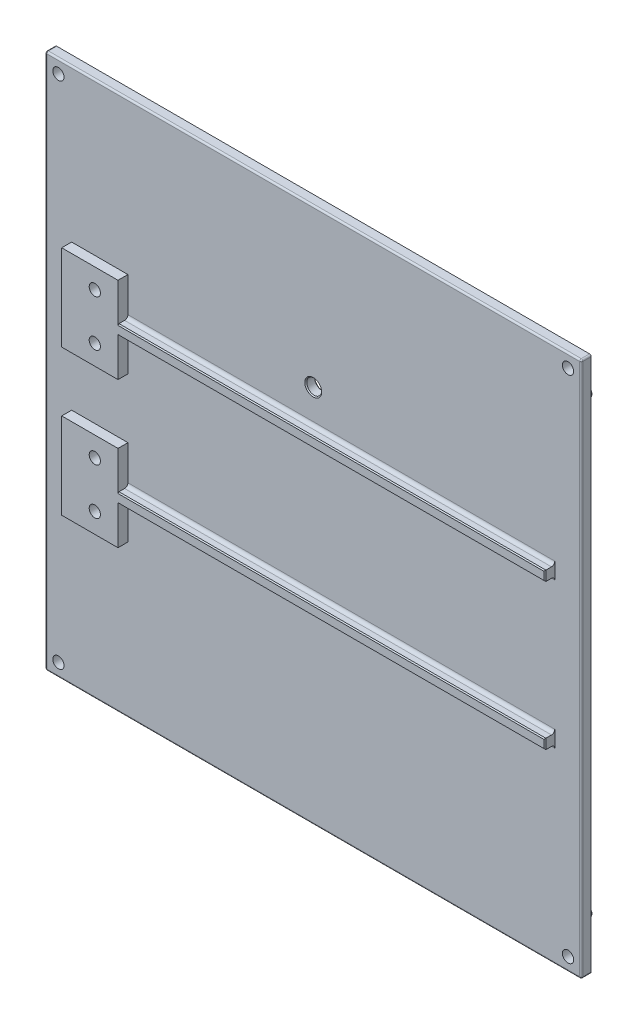
from build123d import *

# Parameters (mm, degrees)
SKETCH_1_W                                  = 162
SKETCH_1_H                                  = 162
EXTRUDE_309_DEPTH                           = 3
SKETCH_2_R                                  = 1.5
EXTRUDE_522_DEPTH                           = 3
MIRROR_568_AT_THE_SECOND_PLANE_COPY_1_SK_R  = 1.5
MIRROR_568_AT_THE_SECOND_PLANE_COPY_1_DEPTH = 3
CHAMFER_595_SIZE                            = 0.3
SKETCH_3_R                                  = 1.7
CUT_EXTRUDE_885_DEPTH                       = 115.590575529
MIRROR_923_AT_THE_SECOND_PLANE_COPY_1_SK_R  = 1.7
MIRROR_923_AT_THE_SECOND_PLANE_COPY_1_DEPTH = 115.590575529
SKETCH_4_W                                  = 20
SKETCH_4_H                                  = 26
EXTRUDE_1171_DEPTH                          = 3
SKETCH_5_R                                  = 1.7
CUT_EXTRUDE_1430_DEPTH                      = 115.904308013
SKETCH_6_R                                  = 2.25
CUT_EXTRUDE_1848_DEPTH                      = 115.708325766
CUT_EXTRUDE_2245_DEPTH                      = 2.6
PATTERN_LINEAR_2_COUNT                      = 2
PATTERN_LINEAR_2_PITCH                      = 14
MIRROR_2370_COPY_1_DEPTH                    = 2.6
SKETCH_8_W                                  = 3
SKETCH_8_H                                  = 26
CUT_EXTRUDE_2563_DEPTH                      = 3
SKETCH_10_W                                 = 129
SKETCH_10_H                                 = 3
EXTRUDE_3082_DEPTH                          = 3
FILLET_2_R                                  = 1
CHAMFER_2_SIZE                              = 0.3
CHAMFER_3_SIZE                              = 0.3
CHAMFER_4_SIZE                              = 0.3
FILLET_3_R                                  = 0.5
FILLET_5_R                                  = 0.5


with BuildPart() as part:
    # Эскиз1 → Extrude 309 (new body)
    with BuildSketch(Plane.XY):
        Rectangle(SKETCH_1_W, SKETCH_1_H)
    extrude(amount=EXTRUDE_309_DEPTH)

    # Эскиз2 → Extrude 522 (add)
    with BuildSketch(Plane(origin=(0, 0, 0), x_dir=(-1, 0, 0), z_dir=(0, 0, -1))):
        with Locations((-77, 68)):
            Circle(SKETCH_2_R)
    extrude_522 = extrude(amount=EXTRUDE_522_DEPTH)

    # Mirror 568: Extrude 522 across plane
    add(extrude_522.mirror(Plane(origin=(0, 0, 0), x_dir=(0, 0, 1), z_dir=(1, 0, 0))))

    # Mirror 568 at the second plane: Extrude 522 across plane
    add(extrude_522.mirror(Plane.ZX))

    # Mirror 568 at the second plane copy 1 sk → Mirror 568 at the second plane copy 1 (add)
    with BuildSketch(Plane(origin=(0, 0, 0), x_dir=(1, 0, 0), z_dir=(0, 0, -1))):
        with Locations((-77, 68)):
            Circle(MIRROR_568_AT_THE_SECOND_PLANE_COPY_1_SK_R)
    extrude(amount=MIRROR_568_AT_THE_SECOND_PLANE_COPY_1_DEPTH)

    # Chamfer 595
    chamfer_595_edges = [part.edges().sort_by_distance(p)[0] for p in [
        (78.5, 68, -3),
        (78.5, -68, -3),
        (-78.5, 68, 0),
        (-78.5, -68, -3),
    ]]
    chamfer(chamfer_595_edges, length=CHAMFER_595_SIZE)

    # Эскиз3 → Cut-Extrude 885 (cut, through all)
    with BuildSketch(Plane(origin=(0, 0, 0), x_dir=(-1, 0, 0), z_dir=(0, 0, -1))):
        with Locations((-77, 77)):
            Circle(SKETCH_3_R)
    cut_extrude_885 = extrude(amount=-CUT_EXTRUDE_885_DEPTH, mode=Mode.SUBTRACT)

    # Mirror 923: Cut-Extrude 885 across plane
    add(cut_extrude_885.mirror(Plane(origin=(0, 0, 0), x_dir=(0, 0, 1), z_dir=(1, 0, 0))), mode=Mode.SUBTRACT)

    # Mirror 923 at the second plane: Cut-Extrude 885 across plane
    add(cut_extrude_885.mirror(Plane.ZX), mode=Mode.SUBTRACT)

    # Mirror 923 at the second plane copy 1 sk → Mirror 923 at the second plane copy 1 (cut, through all)
    with BuildSketch(Plane(origin=(0, 0, 0), x_dir=(1, 0, 0), z_dir=(0, 0, -1))):
        with Locations((-77, 77)):
            Circle(MIRROR_923_AT_THE_SECOND_PLANE_COPY_1_SK_R)
    extrude(amount=-MIRROR_923_AT_THE_SECOND_PLANE_COPY_1_DEPTH, mode=Mode.SUBTRACT)

    # Эскиз4 → Extrude 1171 (add)
    with BuildSketch(Plane.XY.offset(3)):
        with Locations((-63, 22)):
            Rectangle(SKETCH_4_W, SKETCH_4_H)
    extrude_1171 = extrude(amount=EXTRUDE_1171_DEPTH)

    # Эскиз5 → Cut-Extrude 1430 (cut, through all)
    with BuildSketch(Plane.XY.offset(6)):
        with Locations((-63, 29)):
            Circle(SKETCH_5_R)
        with Locations(Location((-63, 15, 0), (0, 0, 180))):
            Circle(SKETCH_5_R)
    cut_extrude_1430 = extrude(amount=-CUT_EXTRUDE_1430_DEPTH, mode=Mode.SUBTRACT)

    # Зеркальное отражение3: Extrude 1171, Cut-Extrude 1430 across plane
    add(extrude_1171.mirror(Plane.ZX))
    add(cut_extrude_1430.mirror(Plane.ZX), mode=Mode.SUBTRACT)

    # Эскиз6 → Cut-Extrude 1848 (cut, through all)
    with BuildSketch(Plane.XY.offset(3)):
        with Locations((0, 33.5)):
            Circle(SKETCH_6_R)
    extrude(amount=-CUT_EXTRUDE_1848_DEPTH, mode=Mode.SUBTRACT)

    # Эскиз7 → Cut-Extrude 2245 (cut)
    with BuildSketch(Plane(origin=(0, 0, 0), x_dir=(-1, 0, 0), z_dir=(0, 0, -1))):
        Polygon((66.348631561, 29), (64.674315781, 31.9), (61.325684219, 31.9), (59.651368439, 29), (61.325684219, 26.1), (64.674315781, 26.1), align=None)
    cut_extrude_2245 = extrude(amount=-CUT_EXTRUDE_2245_DEPTH, mode=Mode.SUBTRACT)

    # Карман2: Cut-Extrude 2245 ×2
    with Locations(*[(0, -i * PATTERN_LINEAR_2_PITCH, 0) for i in range(1, PATTERN_LINEAR_2_COUNT)]):
        add(cut_extrude_2245, mode=Mode.SUBTRACT)

    # Mirror 2370: Cut-Extrude 2245 across plane
    add(cut_extrude_2245.mirror(Plane.ZX), mode=Mode.SUBTRACT)

    # Mirror 2370 copy 1 sketch → Mirror 2370 copy 1 (cut)
    with BuildSketch(Plane(origin=(0, 14, 0), x_dir=(-1, 0, 0), z_dir=(0, 0, -1))):
        Polygon((66.348631561, -29), (64.674315781, -31.9), (61.325684219, -31.9), (59.651368439, -29), (61.325684219, -26.1), (64.674315781, -26.1), align=None)
    extrude(amount=-MIRROR_2370_COPY_1_DEPTH, mode=Mode.SUBTRACT)

    # Эскиз8 → Cut-Extrude 2563 (cut)
    with BuildSketch(Plane.XY.offset(6)):
        with Locations((-54.5, 22)):
            Rectangle(SKETCH_8_W, SKETCH_8_H)
    cut_extrude_2563 = extrude(amount=-CUT_EXTRUDE_2563_DEPTH, mode=Mode.SUBTRACT)

    # Mirror 2615: Cut-Extrude 2563 across plane
    add(cut_extrude_2563.mirror(Plane.ZX), mode=Mode.SUBTRACT)

    # Эскиз10 → Extrude 3082 (add)
    with BuildSketch(Plane.XY.offset(3)):
        with Locations((8.5, 22)):
            Rectangle(SKETCH_10_W, SKETCH_10_H)
    extrude_3082 = extrude(amount=EXTRUDE_3082_DEPTH)

    # Mirror 3134: Extrude 3082 across plane
    add(extrude_3082.mirror(Plane.ZX))

    # Скругление2
    fillet_2_edges = [part.edges().sort_by_distance(p)[0] for p in [
        (8.5, 23.5, 3),
        (8.5, 20.5, 3),
        (8.5, -23.5, 3),
        (8.5, -20.5, 3),
    ]]
    fillet(fillet_2_edges, radius=FILLET_2_R)

    # Фаска2
    chamfer_2_edges = [part.edges().sort_by_distance(p)[0] for p in [
        (8.5, 23.5, 6),
        (8.5, 20.5, 6),
        (8.5, -20.5, 6),
        (8.5, -23.5, 6),
    ]]
    chamfer(chamfer_2_edges, length=CHAMFER_2_SIZE)

    # Фаска3
    chamfer_3_edges = [part.edges().sort_by_distance(p)[0] for p in [
        (73, 22, 6),
        (73, -22, 6),
    ]]
    chamfer(chamfer_3_edges, length=CHAMFER_3_SIZE)

    # Фаска4
    chamfer_4_edges = [part.edges().sort_by_distance(p)[0] for p in [
        (-2.25, 33.5, 0),
        (-2.25, 33.5, 3),
    ]]
    chamfer(chamfer_4_edges, length=CHAMFER_4_SIZE)

    # Скругление3
    fillet_3_edges = [part.edges().sort_by_distance(p)[0] for p in [
        (-81, 0, 3),
        (0, -81, 3),
        (81, 0, 3),
        (0, 81, 3),
    ]]
    fillet(fillet_3_edges, radius=FILLET_3_R)

    # Скругление5
    # the kernel refuses this fillet: 0.5 mm, written as the material it takes off along each edge
    with BuildSketch(Plane(origin=(-80.5, 80.5, 2.5), x_dir=(0, 1, 0), z_dir=(-1, 0, 0))) as fillet_5_piece_1_section:
        Polygon((0, 0), (FILLET_5_R, 0), (FILLET_5_R, -FILLET_5_R), (0, -FILLET_5_R), align=None)
    fillet_5_piece_1 = extrude(amount=FILLET_5_R, mode=Mode.PRIVATE)
    fillet_5_piece_1 = fillet_5_piece_1 - Plane(origin=(-80.5, 80.5, 2.5), x_dir=(0, -0.7071067811865475, -0.7071067811865475), z_dir=(-1, 0, 0)) * Sphere(FILLET_5_R, mode=Mode.PRIVATE)
    add(fillet_5_piece_1, mode=Mode.SUBTRACT)
    with BuildSketch(Plane(origin=(80.5, 80.5, 2.5), x_dir=(1, 0, 0), z_dir=(0, 1, 0))) as fillet_5_piece_2_section:
        Polygon((0, 0), (FILLET_5_R, 0), (FILLET_5_R, -FILLET_5_R), (0, -FILLET_5_R), align=None)
    fillet_5_piece_2 = extrude(amount=FILLET_5_R, mode=Mode.PRIVATE)
    fillet_5_piece_2 = fillet_5_piece_2 - Plane(origin=(80.5, 80.5, 2.5), x_dir=(-0.7071067811865475, 0, -0.7071067811865475), z_dir=(0, 1, 0)) * Sphere(FILLET_5_R, mode=Mode.PRIVATE)
    add(fillet_5_piece_2, mode=Mode.SUBTRACT)
    with BuildSketch(Plane(origin=(-80.5, -80.5, 2.5), x_dir=(0, -1, 0), z_dir=(-1, 0, 0))) as fillet_5_piece_3_section:
        Polygon((0, 0), (FILLET_5_R, 0), (FILLET_5_R, FILLET_5_R), (0, FILLET_5_R), align=None)
    fillet_5_piece_3 = extrude(amount=FILLET_5_R, mode=Mode.PRIVATE)
    fillet_5_piece_3 = fillet_5_piece_3 - Plane(origin=(-80.5, -80.5, 2.5), x_dir=(0, 0.7071067811865475, -0.7071067811865475), z_dir=(-1, 0, 0)) * Sphere(FILLET_5_R, mode=Mode.PRIVATE)
    add(fillet_5_piece_3, mode=Mode.SUBTRACT)
    with BuildSketch(Plane(origin=(80.5, -80.5, 2.5), x_dir=(1, 0, 0), z_dir=(0, -1, 0))) as fillet_5_piece_4_section:
        Polygon((0, 0), (FILLET_5_R, 0), (FILLET_5_R, FILLET_5_R), (0, FILLET_5_R), align=None)
    fillet_5_piece_4 = extrude(amount=FILLET_5_R, mode=Mode.PRIVATE)
    fillet_5_piece_4 = fillet_5_piece_4 - Plane(origin=(80.5, -80.5, 2.5), x_dir=(-0.7071067811865475, 0, -0.7071067811865475), z_dir=(0, -1, 0)) * Sphere(FILLET_5_R, mode=Mode.PRIVATE)
    add(fillet_5_piece_4, mode=Mode.SUBTRACT)
    with BuildSketch(Plane(origin=(81, -81, -1.25), x_dir=(-1, 0, 0), z_dir=(0, 0, 1)), Plane(origin=(-81, -81, -1.25), x_dir=(0, 1, 0), z_dir=(0, 0, 1))) as fillet_5_piece_5:
        with BuildLine():
            CenterArc((FILLET_5_R, -FILLET_5_R), FILLET_5_R, 90, 90)
            Line((0, -FILLET_5_R), (0, 0))
            Line((0, 0), (FILLET_5_R, 0))
        make_face()
    extrude(amount=3.75, mode=Mode.SUBTRACT)
    with BuildSketch(Plane(origin=(81, 81, -1.25), x_dir=(-1, 0, 0), z_dir=(0, 0, 1)), Plane(origin=(-81, 81, -1.25), x_dir=(0, -1, 0), z_dir=(0, 0, 1))) as fillet_5_piece_6:
        with BuildLine():
            CenterArc((FILLET_5_R, FILLET_5_R), FILLET_5_R, 180, 90)
            Line((0, FILLET_5_R), (0, 0))
            Line((0, 0), (FILLET_5_R, 0))
        make_face()
    extrude(amount=3.75, mode=Mode.SUBTRACT)


solid = part.part
